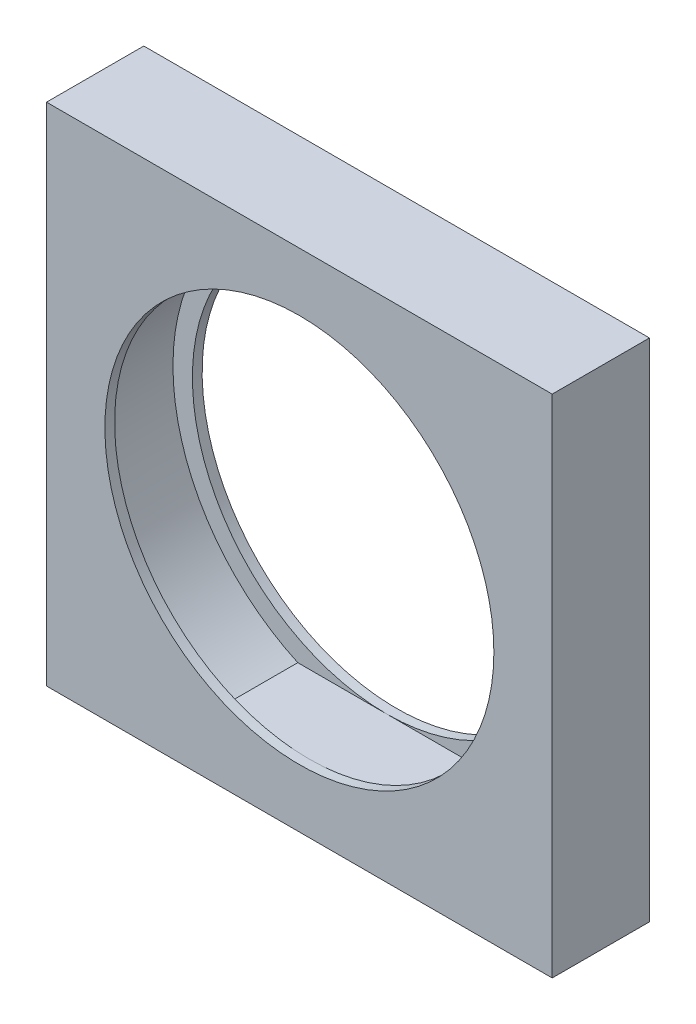
from build123d import *

# Parameters (mm, degrees)
SKETCH_1_W          = 26
SKETCH_1_H          = 26
SKETCH_1_R          = 10
EXTRUDE_1_DEPTH     = 5
CUT_EXTRUDE_START   = 0.5
CUT_EXTRUDE_3_DEPTH = 4


# Read off the part's stored shape, not the designer's step: 切除-拉伸3
with BuildPart() as part:
    # 草图1 → 凸台-拉伸1 (new body)
    with BuildSketch(Plane.XY):
        Rectangle(SKETCH_1_W, SKETCH_1_H)
        Circle(SKETCH_1_R, mode=Mode.SUBTRACT)
    extrude(amount=EXTRUDE_1_DEPTH)

    # 切除-拉伸3 outline → 切除-拉伸3 (cut)
    with BuildSketch(Plane.XY.offset(CUT_EXTRUDE_START)):
        with BuildLine():
            ThreePointArc((4.582575695, -10), (11, 0), (4.582575695, 10))
            Line((4.582575695, 10), (0, 10))
            ThreePointArc((0, 10), (10, 0), (0, -10))
            Line((0, -10), (4.582575695, -10))
        make_face()
        with BuildLine():
            ThreePointArc((0, -10), (-10, 0), (0, 10))
            Line((0, 10), (-4.582575695, 10))
            ThreePointArc((-4.582575695, 10), (-11, 0), (-4.582575695, -10))
            Line((-4.582575695, -10), (0, -10))
        make_face()
    extrude(amount=CUT_EXTRUDE_3_DEPTH, mode=Mode.SUBTRACT)


solid = part.part
